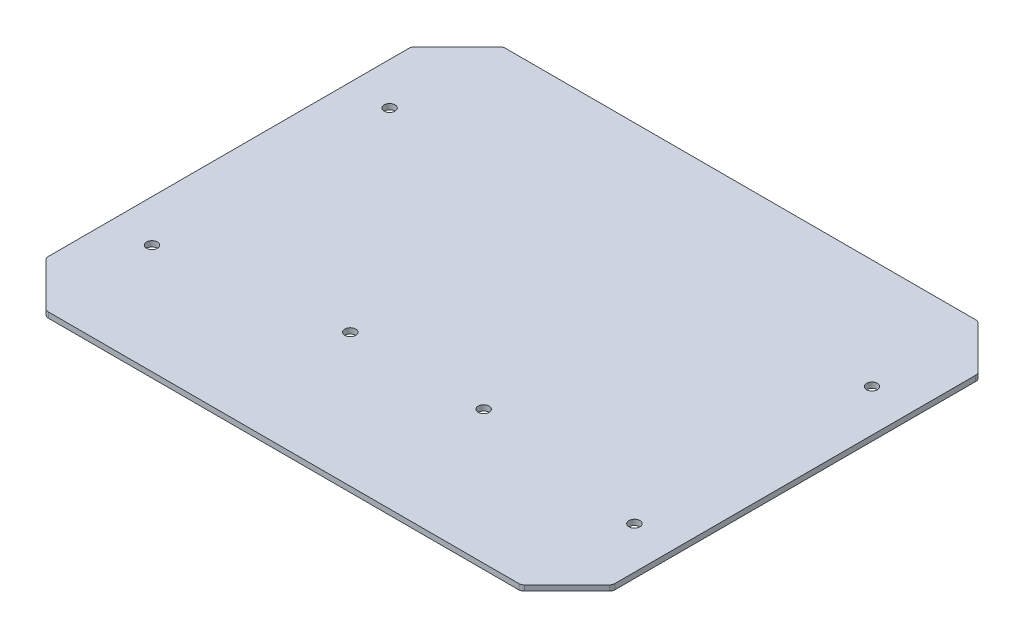
from build123d import *

# Parameters (mm, degrees)
BOSS_EXTRU_1_DEPTH      = 3
CONG_1_R                = 3
ESQUISSE2_R             = 3
PER_AGE_PROFIL_DEPTH    = 200.145675323
ESQUISSE3_R             = 3
ENL_V_MAT_EXTRU_1_DEPTH = 200.145675323


with BuildPart() as part:
    # Esquisse1 → Boss.-Extru.1 (new body)
    with BuildSketch(Plane(origin=(0, 0, 0), x_dir=(1, 0, 0), z_dir=(0, 1, 0))):
        Polygon((-130, 125), (130, 125), (155, 100), (155, -100), (130, -125), (-130, -125), (-155, -100), (-155, 100), align=None)
    extrude(amount=BOSS_EXTRU_1_DEPTH)

    # Congé1
    cong_1_edges = [part.edges().sort_by_distance(p)[0] for p in [
        (-130, 1.5, 125),
        (-155, 1.5, 100),
        (130, 1.5, 125),
        (155, 1.5, 100),
        (155, 1.5, -100),
        (130, 1.5, -125),
        (-130, 1.5, -125),
        (-155, 1.5, -100),
    ]]
    fillet(cong_1_edges, radius=CONG_1_R)

    # Esquisse2 → Perçage Profilé (cut, through all)
    with BuildSketch(Plane(origin=(0, 3, 0), x_dir=(1, 0, 0), z_dir=(0, 1, 0))):
        with Locations((-132, 65)):
            Circle(ESQUISSE2_R)
        with Locations((-132, -65)):
            Circle(ESQUISSE2_R)
        with Locations((132, -65)):
            Circle(ESQUISSE2_R)
        with Locations((132, 65)):
            Circle(ESQUISSE2_R)
    extrude(amount=-PER_AGE_PROFIL_DEPTH, mode=Mode.SUBTRACT)

    # Esquisse3 → Enlèv. mat.-Extru.1 (cut, through all)
    with BuildSketch(Plane(origin=(0, 3, 0), x_dir=(1, 0, 0), z_dir=(0, 1, 0))):
        with Locations((-36.5, -52)):
            Circle(ESQUISSE3_R)
        with Locations((36.5, -52)):
            Circle(ESQUISSE3_R)
    extrude(amount=-ENL_V_MAT_EXTRU_1_DEPTH, mode=Mode.SUBTRACT)


solid = part.part
